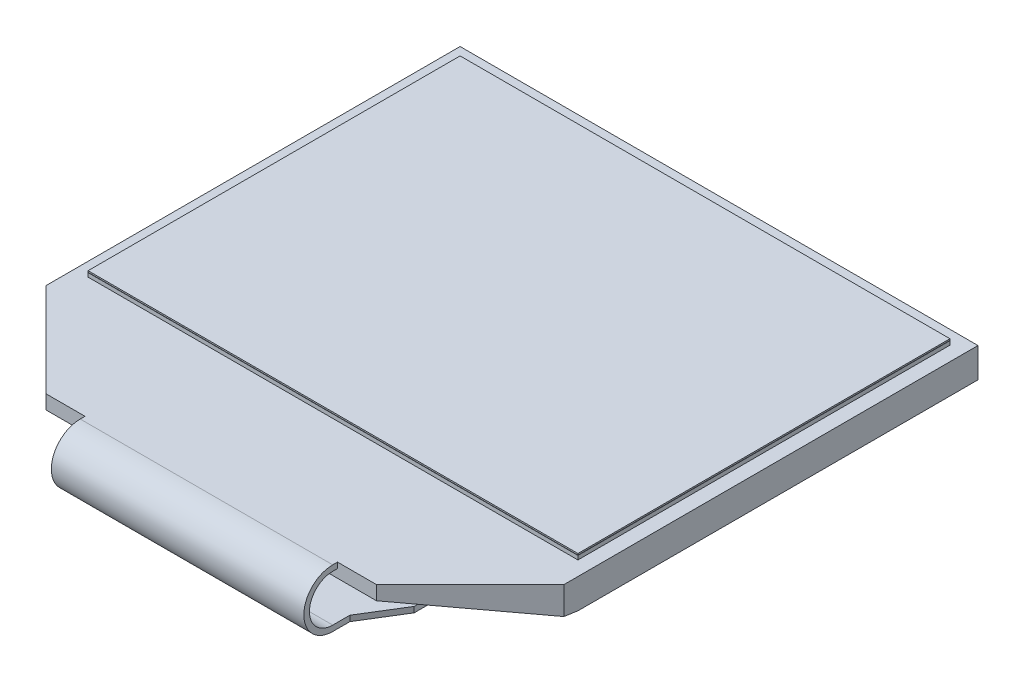
from build123d import *

# Parameters (mm, degrees)
EXTRUDE_1_DEPTH      = 0.5
SKETCH_3_W           = 9.23
SKETCH_3_H           = 14.26
EXTRUDE_2_DEPTH      = 0.56
SKETCH_4_W           = 8.73
SKETCH_4_H           = 13.26
EXTRUDE_3_DEPTH      = 0.14
SKETCH_6_W           = 6.71
SKETCH_6_H           = 10.06
CUT_EXTRUDE_1_DEPTH  = 0.02
EXTRUDE_4_REACH      = 22.328
CUT_EXTRUDE_2_DEPTH  = 21.327946281
SKETCH_9_W           = 8.73
SKETCH_9_H           = 13.26
EXTRUDE_2209_DEPTH   = 0.05
MIRROR_START         = 0.5
MIRROR_1_OUTLINE_W   = 8.73
MIRROR_1_OUTLINE_H   = 0.05
MIRROR_1_DEPTH       = 13.26
MIRROR_1_2_OUTLINE_W = 8.73
MIRROR_1_2_OUTLINE_H = 0.14
MIRROR_1_2_DEPTH     = 13.26
MIRROR_1_3_DEPTH     = 0.48
MIRROR_START_2       = -0.56
MIRROR_1_4_OUTLINE_W = 6.71
MIRROR_1_4_OUTLINE_H = 10.06
MIRROR_1_4_DEPTH     = 0.60719
MIRROR_START_3       = 0.48
MIRROR_1_5_DEPTH     = 0.02
MIRROR_START_4       = -9.23
MIRROR_1_6_DEPTH     = 9.23
MIRROR_START_5       = -20
MIRROR_1_7_OUTLINE_W = 8
MIRROR_1_7_OUTLINE_H = 2
MIRROR_1_7_DEPTH     = 3.036508319
EXTRUDE_6_DEPTH      = 4.5
EXTRUDE_7_DEPTH      = 0.2
SKETCH_15_R          = 0.4
CUT_EXTRUDE_3_DEPTH  = 22.493436207


with BuildPart() as part:
    # 草图2 → 凸台-拉伸1 (new body)
    with BuildSketch(Plane(origin=(0, 0, 0), x_dir=(1, 0, 0), z_dir=(0, 1, 0))):
        Polygon((9.23, -14.76), (5.89, -18.1), (0, -18.1), (0, 0), (9.23, 0), align=None)
    extrude(amount=EXTRUDE_1_DEPTH)

    # 草图3 → 凸台-拉伸2 (add)
    with BuildSketch(Plane.XZ):
        with Locations((4.615, 7.13)):
            Rectangle(SKETCH_3_W, SKETCH_3_H)
    extrude(amount=EXTRUDE_2_DEPTH)

    # 草图6 → 切除-拉伸1 (cut)
    with BuildSketch(Plane(origin=(0, 0.5, 0), x_dir=(1, 0, 0), z_dir=(0, 1, 0))):
        with Locations((3.355, -7.13)):
            Rectangle(SKETCH_6_W, SKETCH_6_H)
    extrude(amount=-CUT_EXTRUDE_1_DEPTH, mode=Mode.SUBTRACT)

    # 凸台-拉伸4: up to this face of the body (flat: up to its plane)
    extrude_4_end = Plane(part.part.faces().sort_by_distance((9.23, -0.025444369, 7.250073411))[0])
    # 草图8 → 凸台-拉伸4 (add, up to the picked face)
    with BuildSketch(Plane.ZY, mode=Mode.PRIVATE) as extrude_4_sk1:
        Polygon((14.26, 0), (18.1, 0), (14.26, -0.56), align=None)
    extrude_4_tool1 = split(extrude(extrude_4_sk1.sketch, amount=-EXTRUDE_4_REACH, mode=Mode.PRIVATE), bisect_by=extrude_4_end, keep=Keep.BOTH, mode=Mode.PRIVATE)
    add(extrude_4_tool1.solids().sort_by(Axis((0, -0.186667, 15.54), (1, 0, 0)))[0])

    # 草图12 → 切除-拉伸2 (cut, through all)
    with BuildSketch(Plane(origin=(0, 0, 0), x_dir=(1, 0, 0), z_dir=(0, 1, 0))):
        Polygon((9.23, -14.76), (5.89, -18.1), (9.23, -18.1), align=None)
    extrude(amount=-CUT_EXTRUDE_2_DEPTH, mode=Mode.SUBTRACT)

    # Mirror 1 3 outline → Mirror 1 3 (add)
    with BuildSketch(Plane(origin=(0, 0, 0), x_dir=(1, 0, 0), z_dir=(0, 1, 0))):
        Polygon((-5.89, -18.1), (0, -18.1), (0, 0), (-9.23, 0), (-9.23, -14.76), align=None)
    extrude(amount=MIRROR_1_3_DEPTH)

    # Mirror 1 4 outline → Mirror 1 4 (add)
    with BuildSketch(Plane(origin=(0, 0, 0), x_dir=(1, 0, 0), z_dir=(0, 1, 0)).offset(MIRROR_START_2)):
        with Locations((-3.355, -7.13)):
            Rectangle(MIRROR_1_4_OUTLINE_W, MIRROR_1_4_OUTLINE_H)
    extrude(amount=MIRROR_1_4_DEPTH)

    # Mirror 1 5 outline → Mirror 1 5 (add)
    with BuildSketch(Plane(origin=(0, 0, 0), x_dir=(1, 0, 0), z_dir=(0, 1, 0)).offset(MIRROR_START_3)):
        Polygon((-5.89, -18.1), (0, -18.1), (0, -12.16), (-6.71, -12.16), (-6.71, -2.1), (0, -2.1), (0, 0), (-9.23, 0), (-9.23, -14.76), align=None)
    extrude(amount=MIRROR_1_5_DEPTH)

    # Mirror 1 6 outline → Mirror 1 6 (add)
    with BuildSketch(Plane.YZ.offset(MIRROR_START_4)):
        Polygon((-0.56, 0), (0, 0), (0, 18.1), (-0.56, 14.26), align=None)
    extrude(amount=MIRROR_1_6_DEPTH)

    # Mirror 1 7 outline → Mirror 1 7 (cut)
    with BuildSketch(Plane(origin=(0, 0, 0), x_dir=(0.707106781186552, 0, 0.7071067811865429), z_dir=(0.707106781186543, 0, -0.707106781186552)).offset(MIRROR_START_5)):
        with Locations((6, 1)):
            Rectangle(MIRROR_1_7_OUTLINE_W, MIRROR_1_7_OUTLINE_H)
    extrude(amount=MIRROR_1_7_DEPTH, mode=Mode.SUBTRACT)

    # 草图11 → 凸台-拉伸6 (add, symmetric)
    with BuildSketch(Plane(origin=(0, 0, 0), x_dir=(0, 0, -1), z_dir=(1, 0, 0))):
        with BuildLine():
            Line((-18.27, -1.56), (-18.27, -1.36))
            ThreePointArc((-18.27, -1.36), (-19.1, -0.53), (-18.27, 0.3))
            Line((-18.27, 0.3), (-18.1, 0.3))
            Line((-18.1, 0.3), (-18.1, 0.5))
            Line((-18.1, 0.5), (-18.27, 0.5))
            ThreePointArc((-18.27, 0.5), (-19.3, -0.53), (-18.27, -1.56))
        make_face()
    extrude(amount=EXTRUDE_6_DEPTH, both=True)

    # 草图14 → 凸台-拉伸7 (add)
    with BuildSketch(Plane(origin=(0, -1.56, 0), x_dir=(-1, 0, 0), z_dir=(0, -1, 0))):
        Polygon((-5.375, -16.24), (-5.375, -11.56), (0, -11.56), (0, -18.27), (-4.5, -18.27), (-4.5, -17.66), align=None)
    extrude_7 = extrude(amount=-EXTRUDE_7_DEPTH)

    # 草图15 → 切除-拉伸3 (cut, through all)
    with BuildSketch(Plane(origin=(0, -1.36, 0), x_dir=(1, 0, 0), z_dir=(0, 1, 0))):
        with Locations(Location((4.475, -15.66, 0), (0, 0, 270))):
            Circle(SKETCH_15_R)
    cut_extrude_3 = extrude(amount=-CUT_EXTRUDE_3_DEPTH, mode=Mode.SUBTRACT)

    # 镜向2: 凸台-拉伸7, 切除-拉伸3 across Right Plane
    add(extrude_7.mirror(Plane(origin=(0, 0, 0), x_dir=(0, 0, -1), z_dir=(1, 0, 0))))
    add(cut_extrude_3.mirror(Plane(origin=(0, 0, 0), x_dir=(0, 0, -1), z_dir=(1, 0, 0))), mode=Mode.SUBTRACT)


with BuildPart() as body_2:
    # 草图4 → 凸台-拉伸3 (new body)
    with BuildSketch(Plane(origin=(0, 0.51, 0), x_dir=(1, 0, 0), z_dir=(0, 1, 0))):
        with Locations((4.365, -7.13)):
            Rectangle(SKETCH_4_W, SKETCH_4_H)
    extrude(amount=EXTRUDE_3_DEPTH)

    # Mirror 1 2 outline → Mirror 1 2 (add)
    with BuildSketch(Plane.XY.offset(MIRROR_START)):
        with Locations((-4.365, 0.58)):
            Rectangle(MIRROR_1_2_OUTLINE_W, MIRROR_1_2_OUTLINE_H)
    extrude(amount=MIRROR_1_2_DEPTH)


with BuildPart() as body_3:
    # 草图9 → Extrude 2209 (new body)
    with BuildSketch(Plane(origin=(0, 0.66, 0), x_dir=(1, 0, 0), z_dir=(0, 1, 0))):
        with Locations((4.365, -7.13)):
            Rectangle(SKETCH_9_W, SKETCH_9_H)
    extrude(amount=EXTRUDE_2209_DEPTH)

    # 镜向1: read off the stored shape, not the designer's step
    # 镜向1 outline → 镜向1 (add)
    with BuildSketch(Plane.XY.offset(MIRROR_START)):
        with Locations((-4.365, 0.685)):
            Rectangle(MIRROR_1_OUTLINE_W, MIRROR_1_OUTLINE_H)
    extrude(amount=MIRROR_1_DEPTH)


solid = Compound([part.part, body_2.part, body_3.part])
